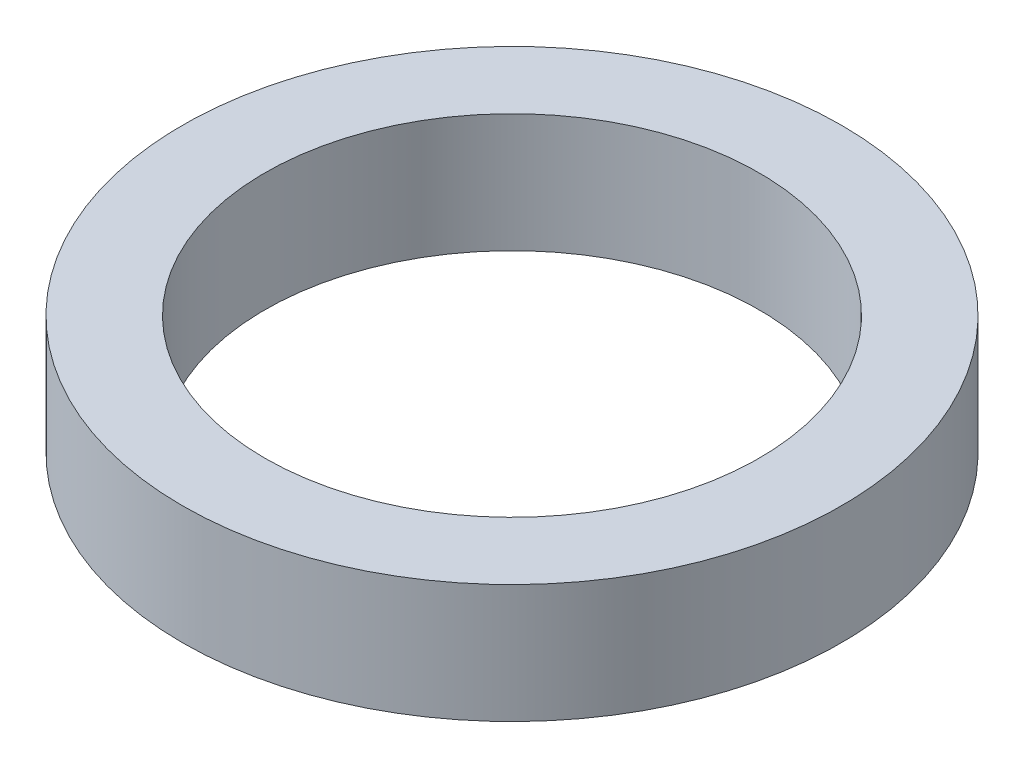
from build123d import *

# Parameters (mm, degrees)
SKETCH1_R           = 50
BOSS_EXTRUDE1_DEPTH = 18
SKETCH2_R           = 37.5
CUT_EXTRUDE1_DEPTH  = 73.965745388


with BuildPart() as part:
    # Sketch1 → Boss-Extrude1 (new body)
    with BuildSketch(Plane(origin=(0, 0, 0), x_dir=(1, 0, 0), z_dir=(0, 1, 0))):
        Circle(SKETCH1_R)
    extrude(amount=BOSS_EXTRUDE1_DEPTH)

    # Sketch2 → Cut-Extrude1 (cut, through all)
    with BuildSketch(Plane(origin=(0, 0, 0), x_dir=(1, 0, 0), z_dir=(0, 1, 0))):
        Circle(SKETCH2_R)
    extrude(amount=CUT_EXTRUDE1_DEPTH, mode=Mode.SUBTRACT)


solid = part.part
